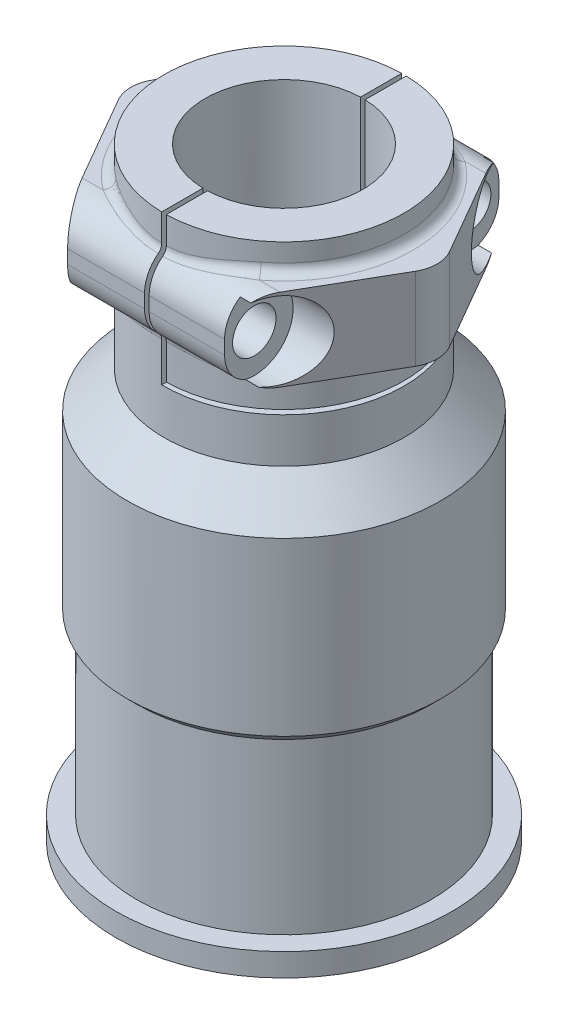
from build123d import *

# Parameters (mm, degrees)
CROQUIS1_R                            = 7.35
SALIENTE_EXTRUIR1_DEPTH               = 1
CROQUIS2_R                            = 6.45
SALIENTE_EXTRUIR2_DEPTH               = 11.4
CROQUIS3_R                            = 6.85
SALIENTE_EXTRUIR3_DEPTH               = 5.5
CHAFL_N1_SIZE                         = 4
CROQUIS4_R                            = 5.25
SALIENTE_EXTRUIR4_DEPTH               = 3.7
SALIENTE_EXTRUIR5_DEPTH               = 3.6
CROQUIS7_R                            = 5.25
SALIENTE_EXTRUIR6_DEPTH               = 1.2
CROQUIS9_W                            = 0.2
CROQUIS9_H                            = 162.503576826
CORTAR_EXTRUIR1_DEPTH                 = 6.55
CROQUIS10_W                           = 59.80265164
CROQUIS10_H                           = 0.2
CORTAR_EXTRUIR2_DEPTH                 = 6.55
CROQUIS15_W                           = 0.875
CROQUIS15_H                           = 14.25
TALADRO_ROSCADO_M2_2X0_451_AT_2_COUNT = 2
TALADRO_ROSCADO_M2_2X0_451_AT_2_PITCH = 9.4
CROQUIS11_R                           = 0.95
CORTAR_EXTRUIR3_DEPTH                 = 6.9
CROQUIS16_R                           = 1.7
CORTAR_EXTRUIR4_DEPTH                 = 3.5
CHAFL_N2_SIZE                         = 1.6
REDONDEO3_R                           = 1.5
REDONDEO4_R                           = 1.5
REDONDEO5_R                           = 1.5
REDONDEO6_R                           = 1.5
REDONDEO7_R                           = 0.4
REDONDEO8_R                           = 0.4
REDONDEO9_R                           = 0.4
REDONDEO10_R                          = 0.4


# Some blends are built 0.0001 mm under size
with BuildPart() as part:
    # Croquis1 → Saliente-Extruir1 (new body)
    with BuildSketch(Plane(origin=(0, 0, 0), x_dir=(1, 0, 0), z_dir=(0, 1, 0))):
        with Locations(Location((0, 0, 0), (0, 0, 270))):
            Circle(CROQUIS1_R)
    extrude(amount=SALIENTE_EXTRUIR1_DEPTH)

    # Croquis2 → Saliente-Extruir2 (add)
    with BuildSketch(Plane(origin=(0, 1, 0), x_dir=(1, 0, 0), z_dir=(0, 1, 0))):
        with Locations(Location((0, 0, 0), (0, 0, 270))):
            Circle(CROQUIS2_R)
    extrude(amount=SALIENTE_EXTRUIR2_DEPTH)

    # Croquis3 → Saliente-Extruir3 (add)
    with BuildSketch(Plane(origin=(0, 12.4, 0), x_dir=(1, 0, 0), z_dir=(0, 1, 0))):
        with Locations(Location((0, 0, 0), (0, 0, 270))):
            Circle(CROQUIS3_R)
    extrude(amount=SALIENTE_EXTRUIR3_DEPTH)

    # Chaflán1
    # the kernel refuses this chamfer: 4 mm, written as the material it adds along each edge
    with BuildSketch(Plane(origin=(0, 12.4, 0), x_dir=(0, 0, 1), z_dir=(-1, 0, 0))) as chafl_n1_piece_1_section:
        Polygon((6.45 + CHAFL_N1_SIZE, 0), (6.45, -CHAFL_N1_SIZE), (6.45, 0), align=None)
    chafl_n1_piece_1 = revolve(axis=Axis((0, 12.4, 0), (0, 1, 0)), mode=Mode.PRIVATE)
    chafl_n1_piece_1 = chafl_n1_piece_1 & Plane(origin=(0, 8.574018439, 0), x_dir=(0, 0, 1), z_dir=(0, -1, 0)) * Cylinder(6.85, 42, mode=Mode.PRIVATE)
    add(chafl_n1_piece_1)

    # Croquis4 → Saliente-Extruir4 (add)
    with BuildSketch(Plane(origin=(0, 17.9, 0), x_dir=(1, 0, 0), z_dir=(0, 1, 0))):
        with Locations(Location((0, 0, 0), (0, 0, 270))):
            Circle(CROQUIS4_R)
    extrude(amount=SALIENTE_EXTRUIR4_DEPTH)

    # Croquis6 → Saliente-Extruir5 (add)
    with BuildSketch(Plane(origin=(0, 21.6, 0), x_dir=(1, 0, 0), z_dir=(0, 1, 0))):
        Polygon((6.92820323, 0), (3.464101615, 6), (-3.464101615, 6), (-6.92820323, 0), (-3.464101615, -6), (3.464101615, -6), align=None)
    extrude(amount=SALIENTE_EXTRUIR5_DEPTH)

    # Croquis7 → Saliente-Extruir6 (add)
    with BuildSketch(Plane(origin=(0, 25.2, 0), x_dir=(1, 0, 0), z_dir=(0, 1, 0))):
        with Locations(Location((0, 0, 0), (0, 0, 270))):
            Circle(CROQUIS7_R)
    extrude(amount=SALIENTE_EXTRUIR6_DEPTH)

    # Croquis8 → Cortar-Revolución1 (revolve, cut)
    with BuildSketch(Plane.XY, mode=Mode.PRIVATE) as cortar_revoluci_n1_sk:
        Polygon((0, 0), (0, 44.002061898), (-3.45, 44.002061898), (-3.45, 17.946133726), (-5.85, 16.5), (-5.85, 0), align=None)
    revolve(cortar_revoluci_n1_sk.sketch.rotate(Axis((0, 0, 0), (0, 1, 0)), 270), axis=Axis((0, 0, 0), (0, 1, 0)), mode=Mode.SUBTRACT)

    # Croquis9 → Cortar-Extruir1 (cut)
    with BuildSketch(Plane(origin=(0, 26.4, 0), x_dir=(1, 0, 0), z_dir=(0, 1, 0))):
        Rectangle(CROQUIS9_W, CROQUIS9_H)
    extrude(amount=-CORTAR_EXTRUIR1_DEPTH, mode=Mode.SUBTRACT)

    # Croquis10 → Cortar-Extruir2 (cut)
    with BuildSketch(Plane.ZY.offset(-0.1)):
        with Locations((24.652278287, 19.95)):
            Rectangle(CROQUIS10_W, CROQUIS10_H)
    extrude(amount=-CORTAR_EXTRUIR2_DEPTH, mode=Mode.SUBTRACT)


with BuildPart() as cortar_extruir2_piece_1:
    # of the separate pieces the step leaves, piece 1, a body of its own (cortar_extruir2_pieces)
    add(part.part.solids().sort_by_distance((0, 19.85, -3.45))[0])

    # Croquis15 → Taladro roscado M2.2x0.451 (revolve, cut)
    with BuildSketch(Plane(origin=(6.9, 23.375277674, 4.7), x_dir=(0, 0, -1), z_dir=(0, 1, 0))):
        with Locations((0.4375, 7.125)):
            Rectangle(CROQUIS15_W, CROQUIS15_H)
    taladro_roscado_m2_2x0_451 = revolve(axis=Axis((13.25, 23.375277674, 4.7), (-1, 0, 0)), mode=Mode.SUBTRACT)

    # Taladro roscado M2.2x0.451 at 2: Taladro roscado M2.2x0.451 ×2
    with Locations(*[(0, 0, -i * TALADRO_ROSCADO_M2_2X0_451_AT_2_PITCH) for i in range(1, TALADRO_ROSCADO_M2_2X0_451_AT_2_COUNT)]):
        add(taladro_roscado_m2_2x0_451, mode=Mode.SUBTRACT)

    # Chaflán2
    chafl_n2_edges = [cortar_extruir2_piece_1.edges().sort_by_distance(p)[0] for p in [
        (0, 17.9, -6.85),
    ]]
    chamfer(chafl_n2_edges, length=CHAFL_N2_SIZE - 0.0001)  # a hair under: the kernel refuses the full size

    # Redondeo4
    redondeo4_edges = [cortar_extruir2_piece_1.edges().sort_by_distance(p)[0] for p in [
        (-1.782050808, 21.6, -6),
        (-1.782050808, 25.2, -6),
        (-1.782050808, 21.6, 6),
        (-1.782050808, 25.2, 6),
    ]]
    fillet(redondeo4_edges, radius=REDONDEO4_R)

    # Redondeo5
    redondeo5_edges = [cortar_extruir2_piece_1.edges().sort_by_distance(p)[0] for p in [
        (-6.92820323, 23.4, 0),
    ]]
    fillet(redondeo5_edges, radius=REDONDEO5_R)

    # Redondeo8
    redondeo8_edges = [cortar_extruir2_piece_1.edges().sort_by_distance(p)[0] for p in [
        (-5.25, 25.2, 0),
        (-1.451467823, 25.097345125, -5.045368289),
        (-1.451467822, 25.097345126, 5.045368289),
    ]]
    fillet(redondeo8_edges, radius=REDONDEO8_R)

    # Redondeo9
    redondeo9_edges = [cortar_extruir2_piece_1.edges().sort_by_distance(p)[0] for p in [
        (-5.25, 21.6, 0),
        (-1.451467823, 21.702654875, -5.045368289),
        (-1.451467822, 21.702654874, 5.045368289),
    ]]
    fillet(redondeo9_edges, radius=REDONDEO9_R)


with BuildPart() as cortar_extruir2_piece_2:
    # of the separate pieces the step leaves, piece 2, a body of its own (cortar_extruir2_pieces)
    add(part.part.solids().sort_by_distance((6.92820323, 21.6, 0))[0])

    # Croquis11 → Cortar-Extruir3 (cut)
    with BuildSketch(Plane.ZY.offset(-6.9)):
        with Locations(Location((-4.7, 23.375277674, 0), (0, 0, 180))):
            Circle(CROQUIS11_R)
        with Locations(Location((4.7, 23.375277674, 0), (0, 0, 180))):
            Circle(CROQUIS11_R)
    extrude(amount=CORTAR_EXTRUIR3_DEPTH, mode=Mode.SUBTRACT)

    # Croquis16 → Cortar-Extruir4 (cut)
    with BuildSketch(Plane.ZY.offset(-6.9)):
        with Locations((4.7, 23.375277674)):
            Circle(CROQUIS16_R)
        with Locations((-4.7, 23.375277674)):
            Circle(CROQUIS16_R)
    extrude(amount=CORTAR_EXTRUIR4_DEPTH, mode=Mode.SUBTRACT)

    # Redondeo3
    # the kernel refuses this fillet: 1.5 mm, written as the material it takes off along each edge
    with BuildSketch(Plane(origin=(7.214101615, 21.6, -6), x_dir=(0, 1, 0), z_dir=(-1, 0, 0))) as redondeo3_piece_1_section:
        with BuildLine():
            CenterArc((REDONDEO3_R, -REDONDEO3_R), REDONDEO3_R, 90, 90)
            Line((0, -REDONDEO3_R), (0, 0))
            Line((0, 0), (REDONDEO3_R, 0))
        make_face()
    redondeo3_piece_1 = extrude(amount=10.864101615, mode=Mode.PRIVATE)
    redondeo3_piece_1 = redondeo3_piece_1 - Plane(origin=(0, 21.739707771, 0), x_dir=(0, 0, 1), z_dir=(0, -1, 0)) * Cylinder(5.25, 28, mode=Mode.PRIVATE)
    add(redondeo3_piece_1, mode=Mode.SUBTRACT)
    with BuildSketch(Plane(origin=(7.214101615, 25.2, -6), x_dir=(0, 0, 1), z_dir=(-1, 0, 0))) as redondeo3_piece_2_section:
        with BuildLine():
            CenterArc((REDONDEO3_R, -REDONDEO3_R), REDONDEO3_R, 90, 90)
            Line((0, -REDONDEO3_R), (0, 0))
            Line((0, 0), (REDONDEO3_R, 0))
        make_face()
    redondeo3_piece_2 = extrude(amount=10.864101615, mode=Mode.PRIVATE)
    redondeo3_piece_2 = redondeo3_piece_2 - Plane(origin=(0, 25.040922338, 0), x_dir=(0, 0, 1), z_dir=(0, -1, 0)) * Cylinder(5.25, 28, mode=Mode.PRIVATE)
    add(redondeo3_piece_2, mode=Mode.SUBTRACT)
    with BuildSketch(Plane(origin=(-3.65, 21.6, 6), x_dir=(0, 1, 0), z_dir=(1, 0, 0))) as redondeo3_piece_3_section:
        with BuildLine():
            CenterArc((REDONDEO3_R, -REDONDEO3_R), REDONDEO3_R, 90, 90)
            Line((0, -REDONDEO3_R), (0, 0))
            Line((0, 0), (REDONDEO3_R, 0))
        make_face()
    redondeo3_piece_3 = extrude(amount=10.864101615, mode=Mode.PRIVATE)
    redondeo3_piece_3 = redondeo3_piece_3 - Plane(origin=(0, 22.232827907, 0), x_dir=(0, 0, 1), z_dir=(0, -1, 0)) * Cylinder(5.25, 28, mode=Mode.PRIVATE)
    add(redondeo3_piece_3, mode=Mode.SUBTRACT)
    with BuildSketch(Plane(origin=(-3.65, 25.2, 6), x_dir=(0, -1, 0), z_dir=(1, 0, 0))) as redondeo3_piece_4_section:
        with BuildLine():
            CenterArc((REDONDEO3_R, REDONDEO3_R), REDONDEO3_R, 180, 90)
            Line((0, REDONDEO3_R), (0, 0))
            Line((0, 0), (REDONDEO3_R, 0))
        make_face()
    redondeo3_piece_4 = extrude(amount=10.864101615, mode=Mode.PRIVATE)
    redondeo3_piece_4 = redondeo3_piece_4 - Plane(origin=(0, 24.485961458, 0), x_dir=(0, 0, 1), z_dir=(0, -1, 0)) * Cylinder(5.25, 28, mode=Mode.PRIVATE)
    add(redondeo3_piece_4, mode=Mode.SUBTRACT)

    # Redondeo6
    redondeo6_edges = [cortar_extruir2_piece_2.edges().sort_by_distance(p)[0] for p in [
        (6.92820323, 23.4, 0),
    ]]
    fillet(redondeo6_edges, radius=REDONDEO6_R)

    # Redondeo7
    redondeo7_edges = [cortar_extruir2_piece_2.edges().sort_by_distance(p)[0] for p in [
        (5.25, 25.2, 0),
        (1.451467821, 25.097345137, -5.045368289),
        (1.451467821, 25.097345137, 5.045368289),
    ]]
    fillet(redondeo7_edges, radius=REDONDEO7_R)

    # Redondeo10
    redondeo10_edges = [cortar_extruir2_piece_2.edges().sort_by_distance(p)[0] for p in [
        (5.25, 21.6, 0),
        (1.451467821, 21.702654863, -5.045368289),
        (1.451467821, 21.702654863, 5.045368289),
    ]]
    fillet(redondeo10_edges, radius=REDONDEO10_R)


solid = Compound([cortar_extruir2_piece_1.part, cortar_extruir2_piece_2.part])
